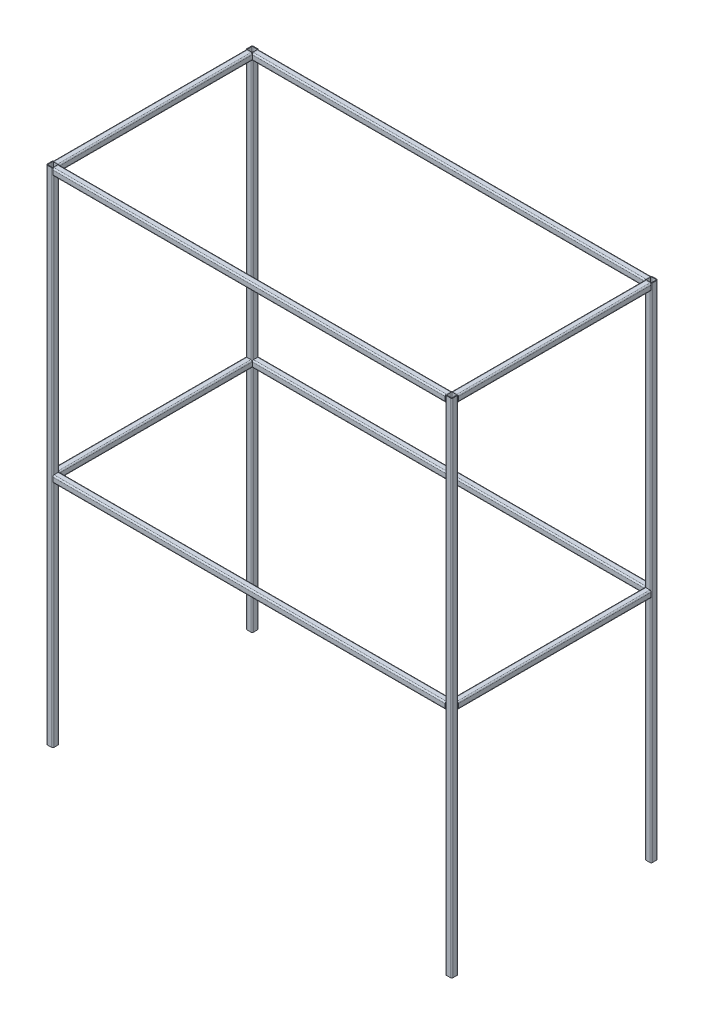
from build123d import *

# Parameters (mm, degrees)
METALON_START                                = -590
METALON_TUBO_QUADRADO_20_X_20_X_2_1_DEPTH    = 1180
METALON_TUBO_QUADRADO_20_X_20_X_2_1_2_DEPTH  = 580
METALON_TUBO_QUADRADO_20_X_20_X_2_1_3_DEPTH  = 580
METALON_TUBO_QUADRADO_20_X_20_X_2_1_4_DEPTH  = 1180
METALON_TUBO_QUADRADO_20_X_20_X_2_1_5_DEPTH  = 580
METALON_TUBO_QUADRADO_20_X_20_X_2_1_6_DEPTH  = 580
METALON_START_2                              = -1100
METALON_TUBO_QUADRADO_20_X_20_X_2_1_7_DEPTH  = 1490
METALON_TUBO_QUADRADO_20_X_20_X_2_1_8_DEPTH  = 1490
METALON_START_3                              = -600
METALON_TUBO_QUADRADO_20_X_20_X_2_1_9_DEPTH  = 1200
METALON_TUBO_QUADRADO_20_X_20_X_2_1_10_DEPTH = 1490
METALON_TUBO_QUADRADO_20_X_20_X_2_1_11_DEPTH = 1200
METALON_TUBO_QUADRADO_20_X_20_X_2_1_12_DEPTH = 1490
BODY_START                                   = 390
BODY_12_RUN_ON_DEPTH                         = 20
BODY_10_RUN_ON_DEPTH                         = 20
BODY_8_RUN_ON_DEPTH                          = 20
BODY_7_RUN_ON_DEPTH                          = 20


with BuildPart() as part:
    # Metalon Tubo quadrado 20 X 20 X 2(1): read off the stored shape, not the designer's step
    # Metalon Tubo quadrado 20 X 20 X 2(1) outl → Metalon Tubo quadrado 20 X 20 X 2(1) (new body)
    with BuildSketch(Plane.YZ.offset(METALON_START)):
        with BuildLine():
            Line((-406, -10), (-394, -10))
            ThreePointArc((-394, -10), (-391.171572875, -8.828427125), (-390, -6))
            Line((-390, -6), (-390, 6))
            ThreePointArc((-390, 6), (-391.171572875, 8.828427125), (-394, 10))
            Line((-394, 10), (-406, 10))
            ThreePointArc((-406, 10), (-408.828427125, 8.828427125), (-410, 6))
            Line((-410, 6), (-410, -6))
            ThreePointArc((-410, -6), (-408.828427125, -8.828427125), (-406, -10))
        make_face()
        with BuildLine():
            ThreePointArc((-408, 6), (-407.414213562, 7.414213562), (-406, 8))
            Line((-406, 8), (-394, 8))
            ThreePointArc((-394, 8), (-392.585786438, 7.414213562), (-392, 6))
            Line((-392, 6), (-392, -6))
            ThreePointArc((-392, -6), (-392.585786438, -7.414213562), (-394, -8))
            Line((-394, -8), (-406, -8))
            ThreePointArc((-406, -8), (-407.414213562, -7.414213562), (-408, -6))
            Line((-408, -6), (-408, 6))
        make_face(mode=Mode.SUBTRACT)
    extrude(amount=METALON_TUBO_QUADRADO_20_X_20_X_2_1_DEPTH)


with BuildPart() as body_2:
    # Metalon Tubo quadrado 20 X 20 X 2_1 2 ou → Metalon Tubo quadrado 20 X 20 X 2_1 2 (new body)
    with BuildSketch(Plane.XY.offset(METALON_START)):
        with BuildLine():
            Line((-590, -406), (-590, -394))
            ThreePointArc((-590, -394), (-591.171572875, -391.171572875), (-594, -390))
            Line((-594, -390), (-606, -390))
            ThreePointArc((-606, -390), (-608.828427125, -391.171572875), (-610, -394))
            Line((-610, -394), (-610, -406))
            ThreePointArc((-610, -406), (-608.828427125, -408.828427125), (-606, -410))
            Line((-606, -410), (-594, -410))
            ThreePointArc((-594, -410), (-591.171572875, -408.828427125), (-590, -406))
        make_face()
        with BuildLine():
            ThreePointArc((-606, -408), (-607.414213562, -407.414213562), (-608, -406))
            Line((-608, -406), (-608, -394))
            ThreePointArc((-608, -394), (-607.414213562, -392.585786438), (-606, -392))
            Line((-606, -392), (-594, -392))
            ThreePointArc((-594, -392), (-592.585786438, -392.585786438), (-592, -394))
            Line((-592, -394), (-592, -406))
            ThreePointArc((-592, -406), (-592.585786438, -407.414213562), (-594, -408))
            Line((-594, -408), (-606, -408))
        make_face(mode=Mode.SUBTRACT)
    extrude(amount=METALON_TUBO_QUADRADO_20_X_20_X_2_1_2_DEPTH)


with BuildPart() as body_3:
    # Metalon Tubo quadrado 20 X 20 X 2_1 3 ou → Metalon Tubo quadrado 20 X 20 X 2_1 3 (new body)
    with BuildSketch(Plane.XY.offset(METALON_START)):
        with BuildLine():
            Line((610, -406), (610, -394))
            ThreePointArc((610, -394), (608.828427125, -391.171572875), (606, -390))
            Line((606, -390), (594, -390))
            ThreePointArc((594, -390), (591.171572875, -391.171572875), (590, -394))
            Line((590, -394), (590, -406))
            ThreePointArc((590, -406), (591.171572875, -408.828427125), (594, -410))
            Line((594, -410), (606, -410))
            ThreePointArc((606, -410), (608.828427125, -408.828427125), (610, -406))
        make_face()
        with BuildLine():
            ThreePointArc((594, -408), (592.585786438, -407.414213562), (592, -406))
            Line((592, -406), (592, -394))
            ThreePointArc((592, -394), (592.585786438, -392.585786438), (594, -392))
            Line((594, -392), (606, -392))
            ThreePointArc((606, -392), (607.414213562, -392.585786438), (608, -394))
            Line((608, -394), (608, -406))
            ThreePointArc((608, -406), (607.414213562, -407.414213562), (606, -408))
            Line((606, -408), (594, -408))
        make_face(mode=Mode.SUBTRACT)
    extrude(amount=METALON_TUBO_QUADRADO_20_X_20_X_2_1_3_DEPTH)


with BuildPart() as body_4:
    # Metalon Tubo quadrado 20 X 20 X 2_1 4 ou → Metalon Tubo quadrado 20 X 20 X 2_1 4 (new body)
    with BuildSketch(Plane.YZ.offset(METALON_START)):
        with BuildLine():
            Line((-406, -610), (-394, -610))
            ThreePointArc((-394, -610), (-391.171572875, -608.828427125), (-390, -606))
            Line((-390, -606), (-390, -594))
            ThreePointArc((-390, -594), (-391.171572875, -591.171572875), (-394, -590))
            Line((-394, -590), (-406, -590))
            ThreePointArc((-406, -590), (-408.828427125, -591.171572875), (-410, -594))
            Line((-410, -594), (-410, -606))
            ThreePointArc((-410, -606), (-408.828427125, -608.828427125), (-406, -610))
        make_face()
        with BuildLine():
            ThreePointArc((-408, -594), (-407.414213562, -592.585786438), (-406, -592))
            Line((-406, -592), (-394, -592))
            ThreePointArc((-394, -592), (-392.585786438, -592.585786438), (-392, -594))
            Line((-392, -594), (-392, -606))
            ThreePointArc((-392, -606), (-392.585786438, -607.414213562), (-394, -608))
            Line((-394, -608), (-406, -608))
            ThreePointArc((-406, -608), (-407.414213562, -607.414213562), (-408, -606))
            Line((-408, -606), (-408, -594))
        make_face(mode=Mode.SUBTRACT)
    extrude(amount=METALON_TUBO_QUADRADO_20_X_20_X_2_1_4_DEPTH)


with BuildPart() as body_5:
    # Metalon Tubo quadrado 20 X 20 X 2_1 5 ou → Metalon Tubo quadrado 20 X 20 X 2_1 5 (new body)
    with BuildSketch(Plane.XY.offset(METALON_START)):
        with BuildLine():
            Line((610, 394), (610, 406))
            ThreePointArc((610, 406), (608.828427125, 408.828427125), (606, 410))
            Line((606, 410), (594, 410))
            ThreePointArc((594, 410), (591.171572875, 408.828427125), (590, 406))
            Line((590, 406), (590, 394))
            ThreePointArc((590, 394), (591.171572875, 391.171572875), (594, 390))
            Line((594, 390), (606, 390))
            ThreePointArc((606, 390), (608.828427125, 391.171572875), (610, 394))
        make_face()
        with BuildLine():
            ThreePointArc((594, 392), (592.585786438, 392.585786438), (592, 394))
            Line((592, 394), (592, 406))
            ThreePointArc((592, 406), (592.585786438, 407.414213562), (594, 408))
            Line((594, 408), (606, 408))
            ThreePointArc((606, 408), (607.414213562, 407.414213562), (608, 406))
            Line((608, 406), (608, 394))
            ThreePointArc((608, 394), (607.414213562, 392.585786438), (606, 392))
            Line((606, 392), (594, 392))
        make_face(mode=Mode.SUBTRACT)
    extrude(amount=METALON_TUBO_QUADRADO_20_X_20_X_2_1_5_DEPTH)


with BuildPart() as body_6:
    # Metalon Tubo quadrado 20 X 20 X 2_1 6 ou → Metalon Tubo quadrado 20 X 20 X 2_1 6 (new body)
    with BuildSketch(Plane.XY.offset(METALON_START)):
        with BuildLine():
            Line((-590, 394), (-590, 406))
            ThreePointArc((-590, 406), (-591.171572875, 408.828427125), (-594, 410))
            Line((-594, 410), (-606, 410))
            ThreePointArc((-606, 410), (-608.828427125, 408.828427125), (-610, 406))
            Line((-610, 406), (-610, 394))
            ThreePointArc((-610, 394), (-608.828427125, 391.171572875), (-606, 390))
            Line((-606, 390), (-594, 390))
            ThreePointArc((-594, 390), (-591.171572875, 391.171572875), (-590, 394))
        make_face()
        with BuildLine():
            ThreePointArc((-606, 392), (-607.414213562, 392.585786438), (-608, 394))
            Line((-608, 394), (-608, 406))
            ThreePointArc((-608, 406), (-607.414213562, 407.414213562), (-606, 408))
            Line((-606, 408), (-594, 408))
            ThreePointArc((-594, 408), (-592.585786438, 407.414213562), (-592, 406))
            Line((-592, 406), (-592, 394))
            ThreePointArc((-592, 394), (-592.585786438, 392.585786438), (-594, 392))
            Line((-594, 392), (-606, 392))
        make_face(mode=Mode.SUBTRACT)
    extrude(amount=METALON_TUBO_QUADRADO_20_X_20_X_2_1_6_DEPTH)


with BuildPart() as body_7:
    # Metalon Tubo quadrado 20 X 20 X 2_1 7 ou → Metalon Tubo quadrado 20 X 20 X 2_1 7 (new body)
    with BuildSketch(Plane(origin=(0, 0, 0), x_dir=(1, 0, 0), z_dir=(0, 1, 0)).offset(METALON_START_2)):
        with BuildLine():
            Line((-590, -6), (-590, 6))
            ThreePointArc((-590, 6), (-591.171572875, 8.828427125), (-594, 10))
            Line((-594, 10), (-606, 10))
            ThreePointArc((-606, 10), (-608.828427125, 8.828427125), (-610, 6))
            Line((-610, 6), (-610, -6))
            ThreePointArc((-610, -6), (-608.828427125, -8.828427125), (-606, -10))
            Line((-606, -10), (-594, -10))
            ThreePointArc((-594, -10), (-591.171572875, -8.828427125), (-590, -6))
        make_face()
        with BuildLine():
            ThreePointArc((-606, -8), (-607.414213562, -7.414213562), (-608, -6))
            Line((-608, -6), (-608, 6))
            ThreePointArc((-608, 6), (-607.414213562, 7.414213562), (-606, 8))
            Line((-606, 8), (-594, 8))
            ThreePointArc((-594, 8), (-592.585786438, 7.414213562), (-592, 6))
            Line((-592, 6), (-592, -6))
            ThreePointArc((-592, -6), (-592.585786438, -7.414213562), (-594, -8))
            Line((-594, -8), (-606, -8))
        make_face(mode=Mode.SUBTRACT)
    extrude(amount=METALON_TUBO_QUADRADO_20_X_20_X_2_1_7_DEPTH)

    # Metalon Tubo quadrado 20 X 20 X 2_1 7 ou → body 7 run on (add)
    with BuildSketch(Plane(origin=(0, 0, 0), x_dir=(1, 0, 0), z_dir=(0, 1, 0)).offset(BODY_START)):
        with BuildLine():
            Line((-590, -6), (-590, 6))
            ThreePointArc((-590, 6), (-591.171572875, 8.828427125), (-594, 10))
            Line((-594, 10), (-606, 10))
            ThreePointArc((-606, 10), (-608.828427125, 8.828427125), (-610, 6))
            Line((-610, 6), (-610, -6))
            ThreePointArc((-610, -6), (-608.828427125, -8.828427125), (-606, -10))
            Line((-606, -10), (-594, -10))
            ThreePointArc((-594, -10), (-591.171572875, -8.828427125), (-590, -6))
        make_face()
        with BuildLine():
            ThreePointArc((-606, -8), (-607.414213562, -7.414213562), (-608, -6))
            Line((-608, -6), (-608, 6))
            ThreePointArc((-608, 6), (-607.414213562, 7.414213562), (-606, 8))
            Line((-606, 8), (-594, 8))
            ThreePointArc((-594, 8), (-592.585786438, 7.414213562), (-592, 6))
            Line((-592, 6), (-592, -6))
            ThreePointArc((-592, -6), (-592.585786438, -7.414213562), (-594, -8))
            Line((-594, -8), (-606, -8))
        make_face(mode=Mode.SUBTRACT)
    extrude(amount=BODY_7_RUN_ON_DEPTH)


with BuildPart() as body_8:
    # Metalon Tubo quadrado 20 X 20 X 2_1 8 ou → Metalon Tubo quadrado 20 X 20 X 2_1 8 (new body)
    with BuildSketch(Plane(origin=(0, 0, 0), x_dir=(1, 0, 0), z_dir=(0, 1, 0)).offset(METALON_START_2)):
        with BuildLine():
            Line((-590, 594), (-590, 606))
            ThreePointArc((-590, 606), (-591.171572875, 608.828427125), (-594, 610))
            Line((-594, 610), (-606, 610))
            ThreePointArc((-606, 610), (-608.828427125, 608.828427125), (-610, 606))
            Line((-610, 606), (-610, 594))
            ThreePointArc((-610, 594), (-608.828427125, 591.171572875), (-606, 590))
            Line((-606, 590), (-594, 590))
            ThreePointArc((-594, 590), (-591.171572875, 591.171572875), (-590, 594))
        make_face()
        with BuildLine():
            ThreePointArc((-606, 592), (-607.414213562, 592.585786438), (-608, 594))
            Line((-608, 594), (-608, 606))
            ThreePointArc((-608, 606), (-607.414213562, 607.414213562), (-606, 608))
            Line((-606, 608), (-594, 608))
            ThreePointArc((-594, 608), (-592.585786438, 607.414213562), (-592, 606))
            Line((-592, 606), (-592, 594))
            ThreePointArc((-592, 594), (-592.585786438, 592.585786438), (-594, 592))
            Line((-594, 592), (-606, 592))
        make_face(mode=Mode.SUBTRACT)
    extrude(amount=METALON_TUBO_QUADRADO_20_X_20_X_2_1_8_DEPTH)

    # Metalon Tubo quadrado 20 X 20 X 2_1 8 ou → body 8 run on (add)
    with BuildSketch(Plane(origin=(0, 0, 0), x_dir=(1, 0, 0), z_dir=(0, 1, 0)).offset(BODY_START)):
        with BuildLine():
            Line((-590, 594), (-590, 606))
            ThreePointArc((-590, 606), (-591.171572875, 608.828427125), (-594, 610))
            Line((-594, 610), (-606, 610))
            ThreePointArc((-606, 610), (-608.828427125, 608.828427125), (-610, 606))
            Line((-610, 606), (-610, 594))
            ThreePointArc((-610, 594), (-608.828427125, 591.171572875), (-606, 590))
            Line((-606, 590), (-594, 590))
            ThreePointArc((-594, 590), (-591.171572875, 591.171572875), (-590, 594))
        make_face()
        with BuildLine():
            ThreePointArc((-606, 592), (-607.414213562, 592.585786438), (-608, 594))
            Line((-608, 594), (-608, 606))
            ThreePointArc((-608, 606), (-607.414213562, 607.414213562), (-606, 608))
            Line((-606, 608), (-594, 608))
            ThreePointArc((-594, 608), (-592.585786438, 607.414213562), (-592, 606))
            Line((-592, 606), (-592, 594))
            ThreePointArc((-592, 594), (-592.585786438, 592.585786438), (-594, 592))
            Line((-594, 592), (-606, 592))
        make_face(mode=Mode.SUBTRACT)
    extrude(amount=BODY_8_RUN_ON_DEPTH)


with BuildPart() as body_9:
    # Metalon Tubo quadrado 20 X 20 X 2_1 9 ou → Metalon Tubo quadrado 20 X 20 X 2_1 9 (new body)
    with BuildSketch(Plane.YZ.offset(METALON_START_3)):
        with BuildLine():
            ThreePointArc((406, -610), (408.828427125, -608.828427125), (410, -606))
            Line((410, -606), (410, -594))
            ThreePointArc((410, -594), (408.828427125, -591.171572875), (406, -590))
            Line((406, -590), (394, -590))
            ThreePointArc((394, -590), (391.171572875, -591.171572875), (390, -594))
            Line((390, -594), (390, -606))
            ThreePointArc((390, -606), (391.171572875, -608.828427125), (394, -610))
            Line((394, -610), (406, -610))
        make_face()
        with BuildLine():
            Line((394, -592), (406, -592))
            ThreePointArc((406, -592), (407.414213562, -592.585786438), (408, -594))
            Line((408, -594), (408, -606))
            ThreePointArc((408, -606), (407.414213562, -607.414213562), (406, -608))
            Line((406, -608), (394, -608))
            ThreePointArc((394, -608), (392.585786438, -607.414213562), (392, -606))
            Line((392, -606), (392, -594))
            ThreePointArc((392, -594), (392.585786438, -592.585786438), (394, -592))
        make_face(mode=Mode.SUBTRACT)
    extrude(amount=METALON_TUBO_QUADRADO_20_X_20_X_2_1_9_DEPTH)

    # Aparar_Estender2 5
    split(bisect_by=Plane(origin=(590, -355, -600), x_dir=(0, -1, 0), z_dir=(-1, 0, 0)), keep=Keep.TOP)

    # Aparar/Estender3
    split(bisect_by=Plane(origin=(-590, -355, -600), x_dir=(0, 1, 0), z_dir=(1, 0, 0)), keep=Keep.TOP)


with BuildPart() as body_10:
    # Metalon Tubo quadrado 20 X 20 X 2_1 10 o → Metalon Tubo quadrado 20 X 20 X 2_1 10 (new body)
    with BuildSketch(Plane(origin=(0, 0, 0), x_dir=(1, 0, 0), z_dir=(0, 1, 0)).offset(METALON_START_2)):
        with BuildLine():
            Line((610, 594), (610, 606))
            ThreePointArc((610, 606), (608.828427125, 608.828427125), (606, 610))
            Line((606, 610), (594, 610))
            ThreePointArc((594, 610), (591.171572875, 608.828427125), (590, 606))
            Line((590, 606), (590, 594))
            ThreePointArc((590, 594), (591.171572875, 591.171572875), (594, 590))
            Line((594, 590), (606, 590))
            ThreePointArc((606, 590), (608.828427125, 591.171572875), (610, 594))
        make_face()
        with BuildLine():
            ThreePointArc((594, 592), (592.585786438, 592.585786438), (592, 594))
            Line((592, 594), (592, 606))
            ThreePointArc((592, 606), (592.585786438, 607.414213562), (594, 608))
            Line((594, 608), (606, 608))
            ThreePointArc((606, 608), (607.414213562, 607.414213562), (608, 606))
            Line((608, 606), (608, 594))
            ThreePointArc((608, 594), (607.414213562, 592.585786438), (606, 592))
            Line((606, 592), (594, 592))
        make_face(mode=Mode.SUBTRACT)
    extrude(amount=METALON_TUBO_QUADRADO_20_X_20_X_2_1_10_DEPTH)

    # Metalon Tubo quadrado 20 X 20 X 2_1 10 o → body 10 run on (add)
    with BuildSketch(Plane(origin=(0, 0, 0), x_dir=(1, 0, 0), z_dir=(0, 1, 0)).offset(BODY_START)):
        with BuildLine():
            Line((610, 594), (610, 606))
            ThreePointArc((610, 606), (608.828427125, 608.828427125), (606, 610))
            Line((606, 610), (594, 610))
            ThreePointArc((594, 610), (591.171572875, 608.828427125), (590, 606))
            Line((590, 606), (590, 594))
            ThreePointArc((590, 594), (591.171572875, 591.171572875), (594, 590))
            Line((594, 590), (606, 590))
            ThreePointArc((606, 590), (608.828427125, 591.171572875), (610, 594))
        make_face()
        with BuildLine():
            ThreePointArc((594, 592), (592.585786438, 592.585786438), (592, 594))
            Line((592, 594), (592, 606))
            ThreePointArc((592, 606), (592.585786438, 607.414213562), (594, 608))
            Line((594, 608), (606, 608))
            ThreePointArc((606, 608), (607.414213562, 607.414213562), (608, 606))
            Line((608, 606), (608, 594))
            ThreePointArc((608, 594), (607.414213562, 592.585786438), (606, 592))
            Line((606, 592), (594, 592))
        make_face(mode=Mode.SUBTRACT)
    extrude(amount=BODY_10_RUN_ON_DEPTH)


with BuildPart() as body_11:
    # Metalon Tubo quadrado 20 X 20 X 2_1 11 o → Metalon Tubo quadrado 20 X 20 X 2_1 11 (new body)
    with BuildSketch(Plane.YZ.offset(METALON_START_3)):
        with BuildLine():
            ThreePointArc((406, -10), (408.828427125, -8.828427125), (410, -6))
            Line((410, -6), (410, 6))
            ThreePointArc((410, 6), (408.828427125, 8.828427125), (406, 10))
            Line((406, 10), (394, 10))
            ThreePointArc((394, 10), (391.171572875, 8.828427125), (390, 6))
            Line((390, 6), (390, -6))
            ThreePointArc((390, -6), (391.171572875, -8.828427125), (394, -10))
            Line((394, -10), (406, -10))
        make_face()
        with BuildLine():
            Line((394, 8), (406, 8))
            ThreePointArc((406, 8), (407.414213562, 7.414213562), (408, 6))
            Line((408, 6), (408, -6))
            ThreePointArc((408, -6), (407.414213562, -7.414213562), (406, -8))
            Line((406, -8), (394, -8))
            ThreePointArc((394, -8), (392.585786438, -7.414213562), (392, -6))
            Line((392, -6), (392, 6))
            ThreePointArc((392, 6), (392.585786438, 7.414213562), (394, 8))
        make_face(mode=Mode.SUBTRACT)
    extrude(amount=METALON_TUBO_QUADRADO_20_X_20_X_2_1_11_DEPTH)

    # Aparar_Estender1 5
    split(bisect_by=Plane(origin=(590, -355, 0), x_dir=(0, -1, 0), z_dir=(-1, 0, 0)), keep=Keep.TOP)

    # Aparar/Estender4
    split(bisect_by=Plane(origin=(-590, -355, 0), x_dir=(0, 1, 0), z_dir=(1, 0, 0)), keep=Keep.TOP)


with BuildPart() as body_12:
    # Metalon Tubo quadrado 20 X 20 X 2_1 12 o → Metalon Tubo quadrado 20 X 20 X 2_1 12 (new body)
    with BuildSketch(Plane(origin=(0, 0, 0), x_dir=(1, 0, 0), z_dir=(0, 1, 0)).offset(METALON_START_2)):
        with BuildLine():
            Line((610, -6), (610, 6))
            ThreePointArc((610, 6), (608.828427125, 8.828427125), (606, 10))
            Line((606, 10), (594, 10))
            ThreePointArc((594, 10), (591.171572875, 8.828427125), (590, 6))
            Line((590, 6), (590, -6))
            ThreePointArc((590, -6), (591.171572875, -8.828427125), (594, -10))
            Line((594, -10), (606, -10))
            ThreePointArc((606, -10), (608.828427125, -8.828427125), (610, -6))
        make_face()
        with BuildLine():
            ThreePointArc((594, -8), (592.585786438, -7.414213562), (592, -6))
            Line((592, -6), (592, 6))
            ThreePointArc((592, 6), (592.585786438, 7.414213562), (594, 8))
            Line((594, 8), (606, 8))
            ThreePointArc((606, 8), (607.414213562, 7.414213562), (608, 6))
            Line((608, 6), (608, -6))
            ThreePointArc((608, -6), (607.414213562, -7.414213562), (606, -8))
            Line((606, -8), (594, -8))
        make_face(mode=Mode.SUBTRACT)
    extrude(amount=METALON_TUBO_QUADRADO_20_X_20_X_2_1_12_DEPTH)

    # Metalon Tubo quadrado 20 X 20 X 2_1 12 o → body 12 run on (add)
    with BuildSketch(Plane(origin=(0, 0, 0), x_dir=(1, 0, 0), z_dir=(0, 1, 0)).offset(BODY_START)):
        with BuildLine():
            Line((610, -6), (610, 6))
            ThreePointArc((610, 6), (608.828427125, 8.828427125), (606, 10))
            Line((606, 10), (594, 10))
            ThreePointArc((594, 10), (591.171572875, 8.828427125), (590, 6))
            Line((590, 6), (590, -6))
            ThreePointArc((590, -6), (591.171572875, -8.828427125), (594, -10))
            Line((594, -10), (606, -10))
            ThreePointArc((606, -10), (608.828427125, -8.828427125), (610, -6))
        make_face()
        with BuildLine():
            ThreePointArc((594, -8), (592.585786438, -7.414213562), (592, -6))
            Line((592, -6), (592, 6))
            ThreePointArc((592, 6), (592.585786438, 7.414213562), (594, 8))
            Line((594, 8), (606, 8))
            ThreePointArc((606, 8), (607.414213562, 7.414213562), (608, 6))
            Line((608, 6), (608, -6))
            ThreePointArc((608, -6), (607.414213562, -7.414213562), (606, -8))
            Line((606, -8), (594, -8))
        make_face(mode=Mode.SUBTRACT)
    extrude(amount=BODY_12_RUN_ON_DEPTH)


solid = Compound([part.part, body_2.part, body_3.part, body_4.part, body_5.part, body_6.part, body_7.part, body_8.part, body_9.part, body_10.part, body_11.part, body_12.part])
